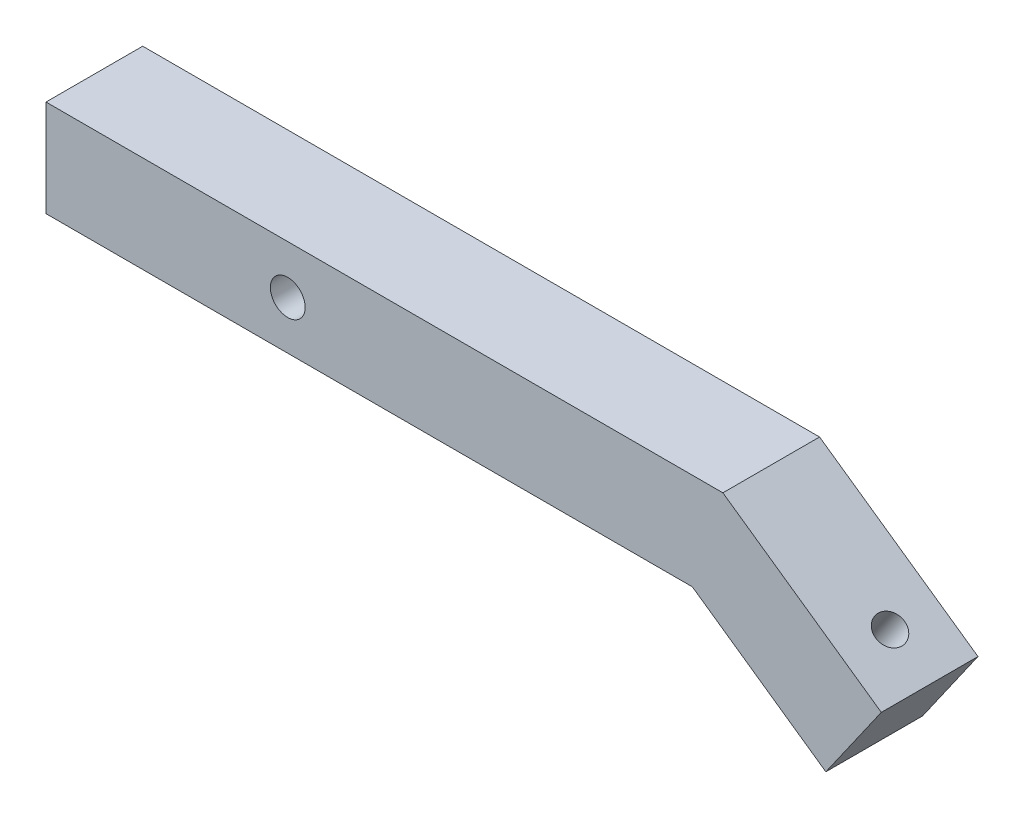
from build123d import *

# Parameters (mm, degrees)
BOSS_EXTRUDE1_DEPTH = 12.7
SKETCH2_R           = 2.286
CUT_EXTRUDE1_DEPTH  = 12.7
SKETCH3_R           = 1.905
CUT_EXTRUDE2_DEPTH  = 12.7


with BuildPart() as part:
    # Sketch1 → Boss-Extrude1 (new body)
    with BuildSketch(Plane.XY):
        Polygon((0, 0), (88.9, 0), (109.706461925, -14.568841483), (102.422041183, -24.972072446), (84.895705381, -12.7), (0, -12.7), align=None)
    extrude(amount=BOSS_EXTRUDE1_DEPTH)

    # Sketch2 → Cut-Extrude1 (cut)
    with BuildSketch(Plane(origin=(0, 0, 0), x_dir=(-1, 0, 0), z_dir=(0, 0, -1))):
        with Locations((-31.75, -6.35)):
            Circle(SKETCH2_R)
    extrude(amount=-CUT_EXTRUDE1_DEPTH, mode=Mode.SUBTRACT)

    # Sketch3 → Cut-Extrude2 (cut)
    with BuildSketch(Plane(origin=(21.962783888, 31.366106031, 0), x_dir=(0.8191520442889908, -0.5735764363510476, 0), z_dir=(-0.5735764363510476, -0.8191520442889909, 0))):
        with Locations((91.872616737, 6.35)):
            Circle(SKETCH3_R)
    extrude(amount=-CUT_EXTRUDE2_DEPTH, mode=Mode.SUBTRACT)


solid = part.part
